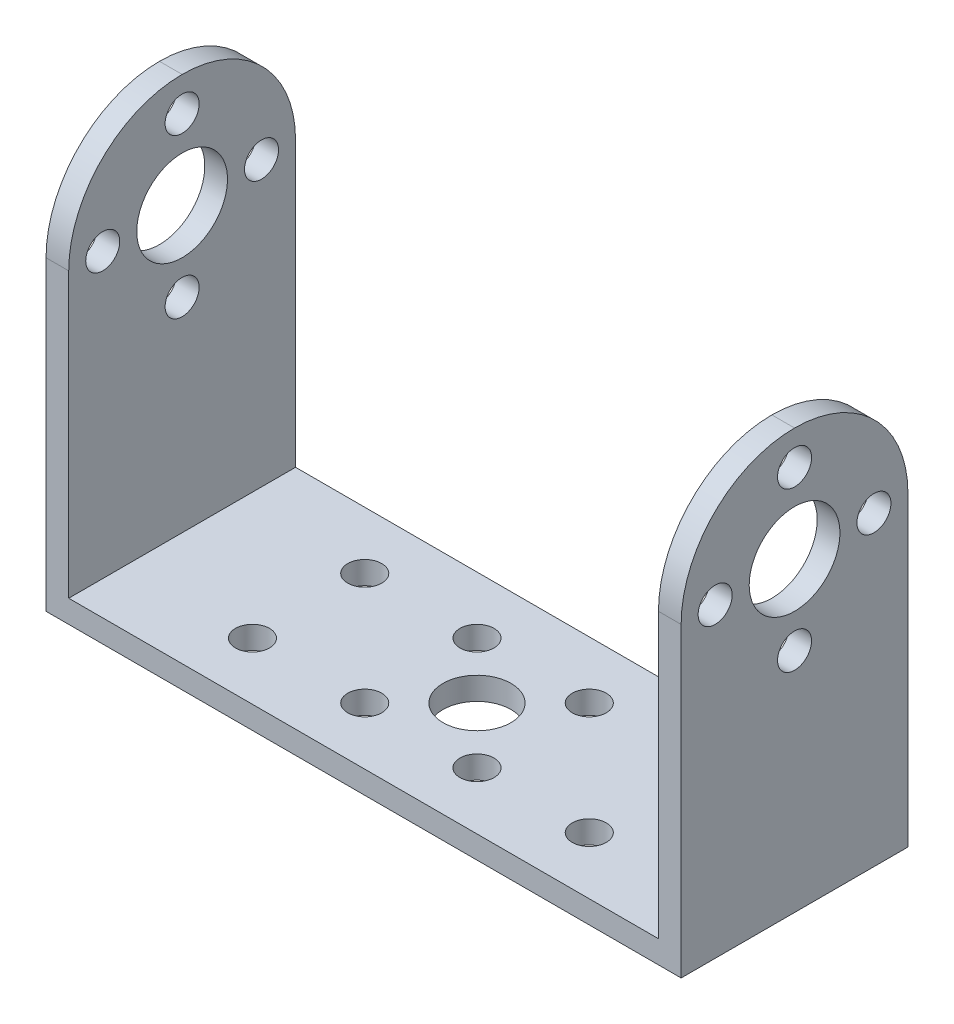
from build123d import *

# Parameters (mm, degrees)
EXTRUDE_1_DEPTH     = 20
FILLET_1_R          = 10
SKETCH_2_R          = 1.5
SKETCH_2_R_2        = 4
CUT_EXTRUDE_1_DEPTH = 71.03570518
SKETCH_3_R          = 3
SKETCH_3_R_2        = 1.5
CUT_EXTRUDE_2_DEPTH = 71.03570518


with BuildPart() as part:
    # 草图1 → 拉伸-薄壁1 (new body)
    with BuildSketch(Plane.XY):
        Polygon((0, 37), (0, 0), (56, 0), (56, 37), (54, 37), (54, 2), (2, 2), (2, 37), align=None)
    extrude(amount=EXTRUDE_1_DEPTH)

    # 圆角1
    fillet_1_edges = [part.edges().sort_by_distance(p)[0] for p in [
        (55, 37, 20),
        (55, 37, 0),
        (1, 37, 0),
        (1, 37, 20),
    ]]
    fillet(fillet_1_edges, radius=FILLET_1_R - 0.0001)  # a hair under: the kernel refuses the full size

    # 草图2 → 切除-拉伸1 (cut, through all)
    with BuildSketch(Plane.ZY):
        with Locations((10, 34)):
            Circle(SKETCH_2_R)
        with Locations((17, 27)):
            Circle(SKETCH_2_R)
        with Locations((10, 20)):
            Circle(SKETCH_2_R)
        with Locations((3, 27)):
            Circle(SKETCH_2_R)
        with Locations((10, 27)):
            Circle(SKETCH_2_R_2)
    extrude(amount=-CUT_EXTRUDE_1_DEPTH, mode=Mode.SUBTRACT)

    # 草图3 → 切除-拉伸2 (cut, through all)
    with BuildSketch(Plane.XZ):
        with Locations(Location((28, 10, 0), (0, 0, 270))):
            Circle(SKETCH_3_R)
        with Locations(Location((32.9495, 14.9495, 0), (0, 0, 270))):
            Circle(SKETCH_3_R_2)
        with Locations(Location((23.0505, 14.9495, 0), (0, 0, 270))):
            Circle(SKETCH_3_R_2)
        with Locations(Location((23.0505, 5.0505, 0), (0, 0, 270))):
            Circle(SKETCH_3_R_2)
        with Locations(Location((32.9495, 5.0505, 0), (0, 0, 270))):
            Circle(SKETCH_3_R_2)
        with Locations(Location((42.8485, 14.9495, 0), (0, 0, 270))):
            Circle(SKETCH_3_R_2)
        with Locations(Location((42.8485, 5.0505, 0), (0, 0, 270))):
            Circle(SKETCH_3_R_2)
        with Locations(Location((13.1515, 5.0505, 0), (0, 0, 270))):
            Circle(SKETCH_3_R_2)
        with Locations(Location((13.1515, 14.9495, 0), (0, 0, 270))):
            Circle(SKETCH_3_R_2)
    extrude(amount=-CUT_EXTRUDE_2_DEPTH, mode=Mode.SUBTRACT)


solid = part.part
